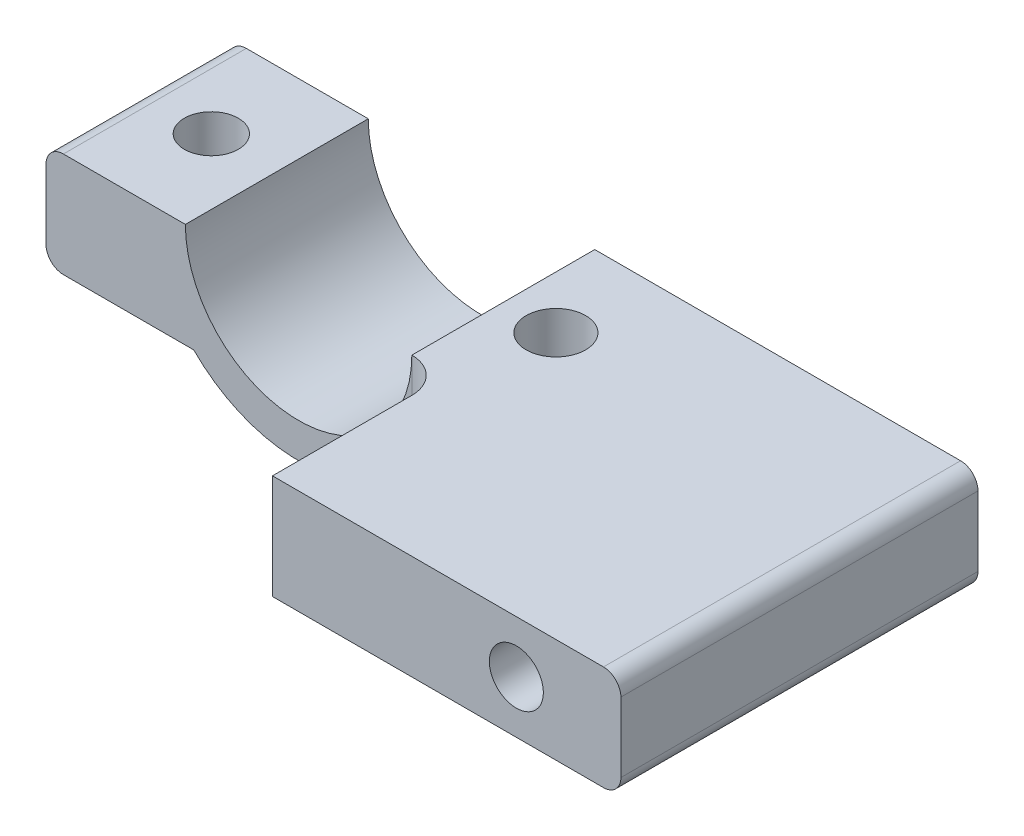
from build123d import *

# Parameters (mm, degrees)
EXTRUDE_1_DEPTH     = 10.5
SKETCH_2_R          = 1.55
CUT_EXTRUDE_1_DEPTH = 31.959651161
SKETCH_3_R          = 1.70728631
CUT_EXTRUDE_2_DEPTH = 31.959651161
SKETCH_5_W          = 20
SKETCH_5_H          = 6
EXTRUDE_2_DEPTH     = 10
SKETCH_6_R          = 1.55
CUT_EXTRUDE_4_DEPTH = 10
FILLET_1_R          = 2
FILLET_2_R          = 1


with BuildPart() as part:
    # 草图1 → 凸台-拉伸1 (new body)
    with BuildSketch(Plane.XY):
        with BuildLine():
            Line((-14.5, -6), (-6.020797289, -6))
            ThreePointArc((-6.020797289, -6), (0, -8.5), (6.020797289, -6))
            Line((6.020797289, -6), (28.5, -6))
            Line((28.5, -6), (28.5, 0))
            Line((28.5, 0), (6.5, 0))
            ThreePointArc((6.5, 0), (0, -6.5), (-6.5, 0))
            Line((-6.5, 0), (-14.5, 0))
            Line((-14.5, 0), (-14.5, -6))
        make_face()
    extrude(amount=EXTRUDE_1_DEPTH)

    # 草图2 → 切除-拉伸1 (cut, through all)
    with BuildSketch(Plane.XZ.offset(6)):
        with Locations((-10.260398645, 5.25)):
            Circle(SKETCH_2_R)
    extrude(amount=-CUT_EXTRUDE_1_DEPTH, mode=Mode.SUBTRACT)

    # 草图3 → 切除-拉伸2 (cut, through all)
    with BuildSketch(Plane.XZ.offset(6)):
        with Locations((9.520797289, 5.25)):
            Circle(SKETCH_3_R)
    extrude(amount=-CUT_EXTRUDE_2_DEPTH, mode=Mode.SUBTRACT)

    # 草图5 → 凸台-拉伸2 (add)
    with BuildSketch(Plane.XY.offset(10.5)):
        with Locations((18.5, -3)):
            Rectangle(SKETCH_5_W, SKETCH_5_H)
    extrude(amount=EXTRUDE_2_DEPTH)

    # 草图6 → 切除-拉伸4 (cut)
    with BuildSketch(Plane.XY.offset(20.5)):
        with Locations((22.5, -3)):
            Circle(SKETCH_6_R)
    extrude(amount=-CUT_EXTRUDE_4_DEPTH, mode=Mode.SUBTRACT)

    # 圆角1
    fillet_1_edges = [part.edges().sort_by_distance(p)[0] for p in [
        (8.5, -3, 10.5),
    ]]
    fillet(fillet_1_edges, radius=FILLET_1_R)

    # 圆角2
    fillet_2_edges = [part.edges().sort_by_distance(p)[0] for p in [
        (28.5, 0, 10.25),
        (28.5, -6, 10.25),
        (-14.5, -6, 5.25),
        (-14.5, 0, 5.25),
    ]]
    fillet(fillet_2_edges, radius=FILLET_2_R)


solid = part.part
